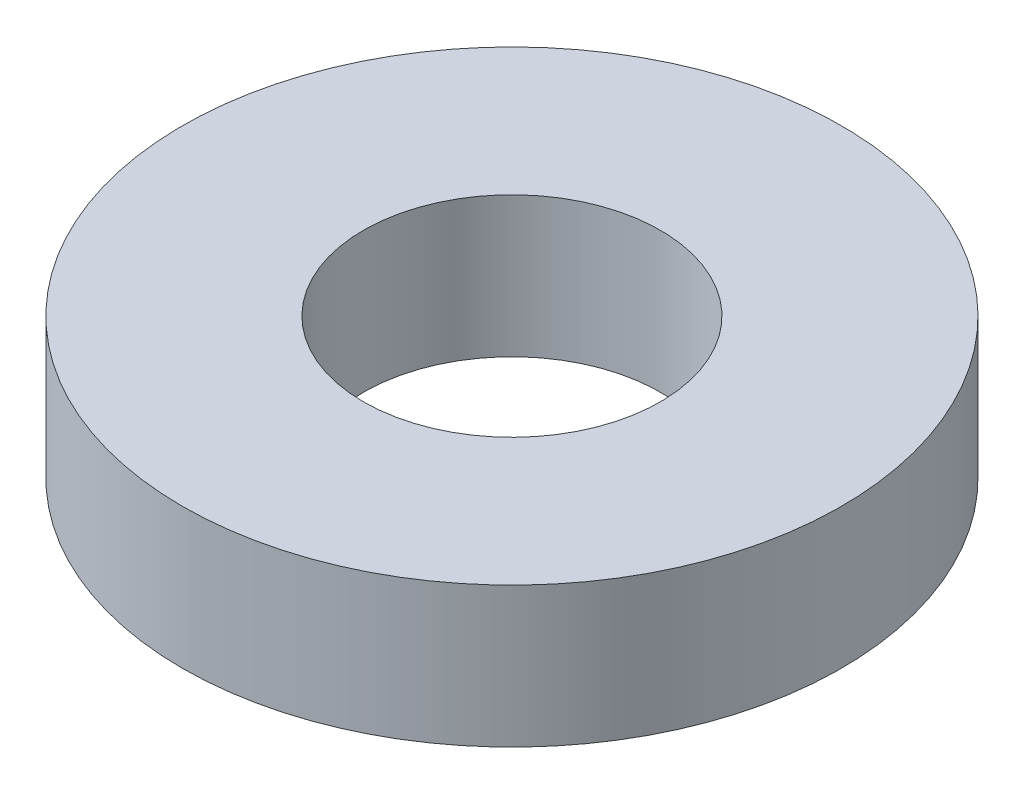
from build123d import *

# Parameters (mm, degrees)
SKETCH1_R           = 13.6
SKETCH1_R_2         = 6.13
BOSS_EXTRUDE1_DEPTH = 2.895


with BuildPart() as part:
    # Sketch1 → Boss-Extrude1 (new, symmetric)
    with BuildSketch(Plane(origin=(0, 0, 0), x_dir=(1, 0, 0), z_dir=(0, 1, 0))):
        Circle(SKETCH1_R)
        Circle(SKETCH1_R_2, mode=Mode.SUBTRACT)
    extrude(amount=BOSS_EXTRUDE1_DEPTH, both=True)


solid = part.part
